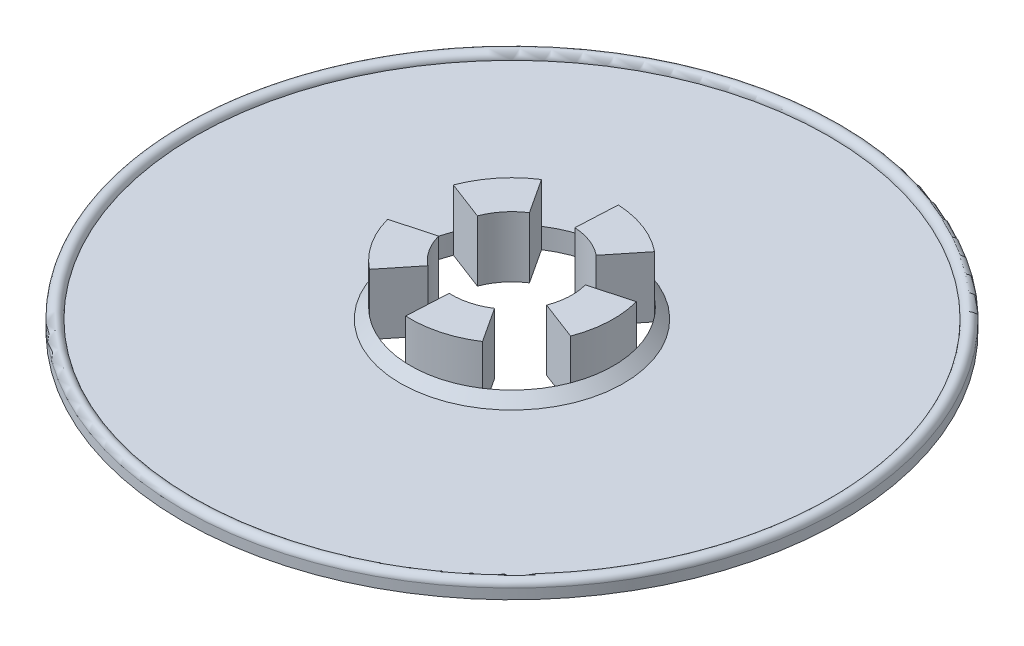
from build123d import *

# Parameters (mm, degrees)
SKETCH1_R           = 41.275
BOSS_EXTRUDE1_DEPTH = 1.27
SKETCH6_R           = 12.7
BOSS_EXTRUDE3_DEPTH = 6.35
CHAMFER2_SIZE       = 1.27
CUT_EXTRUDE2_DEPTH  = 59.866931719


with BuildPart() as part:
    # Sketch1 → Boss-Extrude1 (new body)
    with BuildSketch(Plane(origin=(0, 0, 0), x_dir=(1, 0, 0), z_dir=(0, 1, 0))):
        Circle(SKETCH1_R)
    extrude(amount=BOSS_EXTRUDE1_DEPTH)

    # Sketch6 → Boss-Extrude3 (add)
    with BuildSketch(Plane(origin=(0, 1.27, 0), x_dir=(1, 0, 0), z_dir=(0, 1, 0))):
        Circle(SKETCH6_R)
    extrude(amount=BOSS_EXTRUDE3_DEPTH)

    # Chamfer2
    chamfer2_edges = [part.edges().sort_by_distance(p)[0] for p in [
        (-12.7, 1.27, 0),
    ]]
    chamfer(chamfer2_edges, length=CHAMFER2_SIZE)

    # Sketch4 → Cut-Extrude2 (cut, through all)
    with BuildSketch(Plane.XZ):
        with BuildLine():
            ThreePointArc((11.86615569, 4.52596389), (9.886784934, 7.971291217), (6.939626784, 10.636333019))
            Line((6.939626784, 10.636333019), (4.098204794, 6.281299027))
            ThreePointArc((4.098204794, 6.281299027), (1.956596228, 7.240285298), (-0.376537609, 7.490541998))
            Line((-0.376537609, 7.490541998), (-0.637603684, 12.683984451))
            ThreePointArc((-0.637603684, 12.683984451), (-4.52596389, 11.86615569), (-7.971291217, 9.886784934))
            Line((-7.971291217, 9.886784934), (-4.707455443, 5.83865252))
            ThreePointArc((-4.707455443, 5.83865252), (-6.281299027, 4.098204794), (-7.240285298, 1.956596228))
            Line((-7.240285298, 1.956596228), (-12.260216438, 3.313169613))
            ThreePointArc((-12.260216438, 3.313169613), (-12.683984451, -0.637603684), (-11.86615569, -4.52596389))
            Line((-11.86615569, -4.52596389), (-7.007572258, -2.672813321))
            ThreePointArc((-7.007572258, -2.672813321), (-5.83865252, -4.707455443), (-4.098204794, -6.281299027))
            Line((-4.098204794, -6.281299027), (-6.939626784, -10.636333019))
            ThreePointArc((-6.939626784, -10.636333019), (-3.313169613, -12.260216438), (0.637603684, -12.683984451))
            Line((0.637603684, -12.683984451), (0.376537609, -7.490541998))
            ThreePointArc((0.376537609, -7.490541998), (2.672813321, -7.007572258), (4.707455443, -5.83865252))
            Line((4.707455443, -5.83865252), (7.971291217, -9.886784934))
            ThreePointArc((7.971291217, -9.886784934), (10.636333019, -6.939626784), (12.260216438, -3.313169613))
            Line((12.260216438, -3.313169613), (7.240285298, -1.956596228))
            ThreePointArc((7.240285298, -1.956596228), (7.490541998, 0.376537609), (7.007572258, 2.672813321))
            Line((7.007572258, 2.672813321), (11.86615569, 4.52596389))
        make_face()
    extrude(amount=-CUT_EXTRUDE2_DEPTH, mode=Mode.SUBTRACT)

    # Sketch7 → Revolve1 (revolve)
    with BuildSketch(Plane.XY):
        with BuildLine():
            Line((-41.275, 1.27), (-39.68496, 1.27))
            ThreePointArc((-39.68496, 1.27), (-40.47998, 2.06502), (-41.275, 1.27))
        make_face()
    revolve(axis=Axis((0, 8.001, 0), (0, -1, 0)))


solid = part.part
